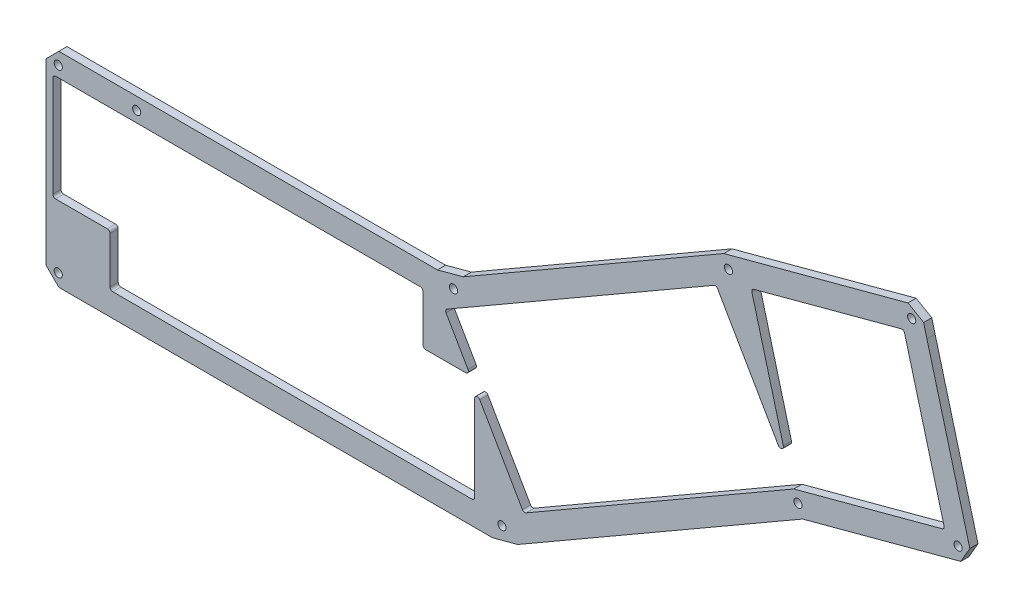
from build123d import *

# Parameters (mm, degrees)
ESQUISSE1_R        = 1.5
BOSS_EXTRU_1_DEPTH = 3


with BuildPart() as part:
    # Esquisse1 → Boss.-Extru.1 (new body)
    with BuildSketch(Plane.XY):
        Polygon((-75.988646329, 48.585106383), (43.370413486, 48.585106383), (52.827707053, 51.119180557), (148.408882575, 106.302997974), (211.31726809, 123.15924907), (216.00177767, 124.414459628), (221.738024707, 121.080528556), (222.951970937, 116.443128315), (227.61108718, 99.055069775), (238.68670294, 57.720309033), (235.358275815, 51.955304144), (177.357802021, 36.41412403), (72.805860085, -23.948967791), (63.602899614, -26.414893617), (-95.546655781, -26.414893617), (-100.253762562, -21.707786836), (-100.253762562, 35.79522772), (-100.253762562, 43.877999602), (-95.546655781, 48.585106383), align=None)
        with Locations((-95.753762562, 44.085106383)):
            Circle(ESQUISSE1_R, mode=Mode.SUBTRACT)
        with Locations((-95.753762562, -21.914893617)):
            Circle(ESQUISSE1_R, mode=Mode.SUBTRACT)
        with Locations((67.039694146, -20.835264486)):
            Circle(ESQUISSE1_R, mode=Mode.SUBTRACT)
        with Locations((49.263745973, 45.505477252)):
            Circle(ESQUISSE1_R, mode=Mode.SUBTRACT)
        with Locations((175.637377655, 40.567595866)):
            Circle(ESQUISSE1_R, mode=Mode.SUBTRACT)
        with Locations((150.12930694, 102.149526137)):
            Circle(ESQUISSE1_R, mode=Mode.SUBTRACT)
        with Locations((234.393639901, 56.355573542)):
            Circle(ESQUISSE1_R, mode=Mode.SUBTRACT)
        with Locations((217.363403759, 120.120565138)):
            Circle(ESQUISSE1_R, mode=Mode.SUBTRACT)
        with Locations((-66.988646329, 44.085106383)):
            Circle(ESQUISSE1_R, mode=Mode.SUBTRACT)
        with BuildLine():
            Line((-97.753762562, 39.085106383), (-97.753762562, 2.085106383))
            ThreePointArc((-97.753762562, 2.085106383), (-97.460869343, 1.377999602), (-96.753762562, 1.085106383))
            Line((-96.753762562, 1.085106383), (-77.753762562, 1.085106383))
            ThreePointArc((-77.753762562, 1.085106383), (-77.046655781, 0.792213164), (-76.753762562, 0.085106383))
            Line((-76.753762562, 0.085106383), (-76.753762562, -16.914893617))
            ThreePointArc((-76.753762562, -16.914893617), (-76.460869343, -17.622000398), (-75.753762562, -17.914893617))
            Line((-75.753762562, -17.914893617), (56.011353671, -17.914893617))
            ThreePointArc((56.011353671, -17.914893617), (56.718460453, -17.622000398), (57.011353671, -16.914893617))
            Line((57.011353671, -16.914893617), (57.011353671, 14.621004768))
            ThreePointArc((57.011353671, 14.621004768), (57.752534626, 15.586930594), (58.877379075, 15.121004768))
            Line((58.877379075, 15.121004768), (74.527293708, -11.98544251))
            ThreePointArc((74.527293708, -11.98544251), (75.134500067, -12.451368337), (75.893319112, -12.351467914))
            Line((75.893319112, -12.351467914), (174.076924484, 44.334863077))
            Line((174.076924484, 44.334863077), (228.528734589, 58.925181621))
            ThreePointArc((228.528734589, 58.925181621), (229.135940948, 59.391107448), (229.235841371, 60.149926493))
            Line((229.235841371, 60.149926493), (214.741974845, 114.241772765))
            ThreePointArc((214.741974845, 114.241772765), (214.276049019, 114.848979124), (213.517229973, 114.948879546))
            Line((213.517229973, 114.948879546), (159.425383701, 100.45501302))
            ThreePointArc((159.425383701, 100.45501302), (158.818177343, 99.989087194), (158.71827692, 99.230268149))
            Line((158.71827692, 99.230268149), (170.271736655, 56.112169417))
            ThreePointArc((170.271736655, 56.112169417), (169.688494261, 54.929470839), (168.439785425, 55.353350371))
            Line((168.439785425, 55.353350371), (146.120215143, 94.011980101))
            ThreePointArc((146.120215143, 94.011980101), (145.513008785, 94.477905928), (144.75418974, 94.378005505))
            Line((144.75418974, 94.378005505), (46.893319112, 37.878005505))
            ThreePointArc((46.893319112, 37.878005505), (46.427393286, 37.270799147), (46.527293708, 36.511980101))
            Line((46.527293708, 36.511980101), (54.567977999, 22.585106383))
            ThreePointArc((54.567977999, 22.585106383), (54.567977999, 21.585106383), (53.701952595, 21.085106383))
            Line((53.701952595, 21.085106383), (39.011353671, 21.085106383))
            ThreePointArc((39.011353671, 21.085106383), (38.30424689, 21.377999602), (38.011353671, 22.085106383))
            Line((38.011353671, 22.085106383), (38.011353671, 39.085106383))
            ThreePointArc((38.011353671, 39.085106383), (37.718460453, 39.792213164), (37.011353671, 40.085106383))
            Line((37.011353671, 40.085106383), (-96.753762562, 40.085106383))
            ThreePointArc((-96.753762562, 40.085106383), (-97.460869343, 39.792213164), (-97.753762562, 39.085106383))
        make_face(mode=Mode.SUBTRACT)
    extrude(amount=BOSS_EXTRU_1_DEPTH)


solid = part.part
